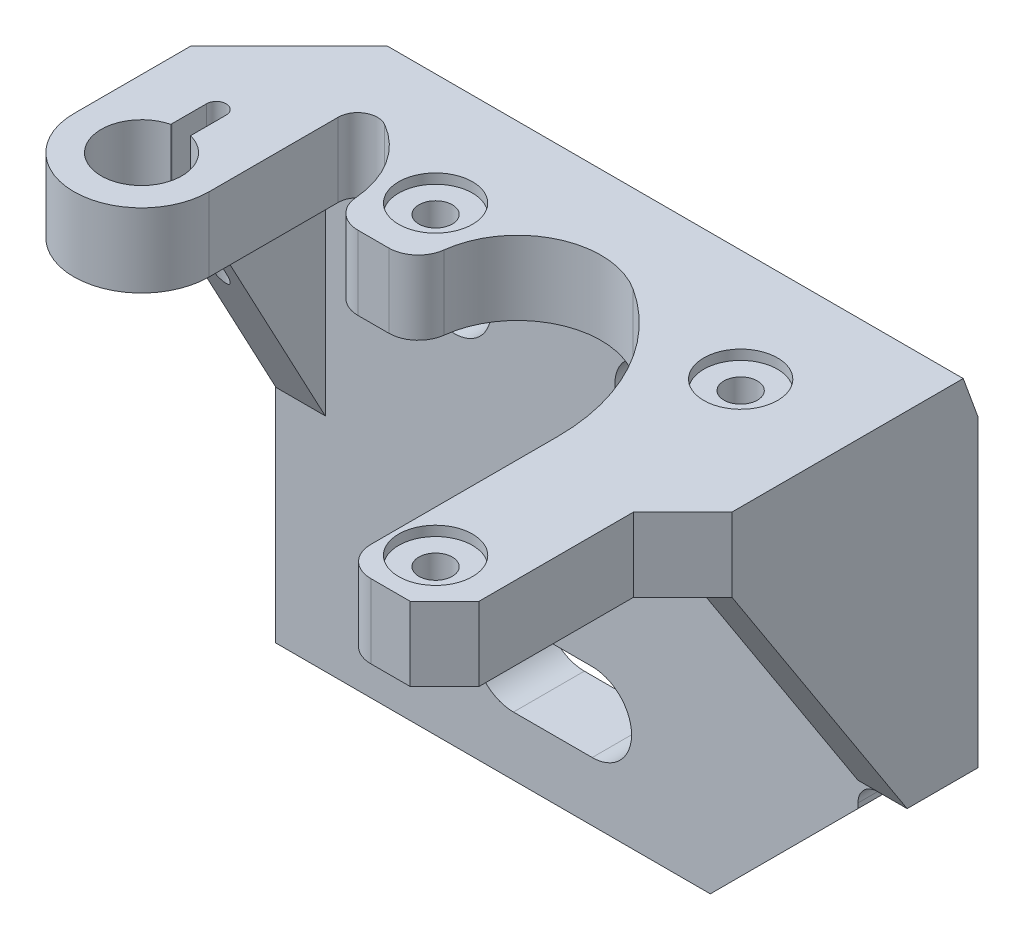
from build123d import *

# Parameters (mm, degrees)
SZKIC1_W                    = 65
SZKIC1_H                    = 52.5
SZKIC1_R                    = 1.7
DODANIE_WYCI_GNI_CIE1_DEPTH = 7.2
SZKIC2_W                    = 22.2
SZKIC2_H                    = 17.2
WYTNIJ_WYCI_GNI_CIE1_DEPTH  = 3.4
ZAOKR_GLENIE1_R             = 2
SZKIC3_R                    = 3.7
WYTNIJ_WYCI_GNI_CIE2_DEPTH  = 3.3
SZKIC4_W                    = 10.5
SZKIC4_H                    = 7.5
DODANIE_WYCI_GNI_CIE2_DEPTH = 42
SZKIC5_R                    = 3.75
WYTNIJ_WYCI_GNI_CIE3_DEPTH  = 1
WYTNIJ_WYCI_GNI_CIE4_REACH  = 80.923
SZKIC6_R                    = 1.7
ZAOKR_GLENIE2_R             = 20
SFAZOWANIE1_SIZE            = 3.5
SZKIC7_W                    = 9
SZKIC7_H                    = 7.5
DODANIE_WYCI_GNI_CIE3_DEPTH = 12
WYTNIJ_WYCI_GNI_CIE5_REACH  = 81.579
SZKIC8_R                    = 1.7
SZKIC9_R                    = 3.75
WYTNIJ_WYCI_GNI_CIE6_DEPTH  = 1
ZAOKR_GLENIE3_R             = 10
ZAOKR_GLENIE4_R             = 8.5
DODANIE_WYCI_GNI_CIE4_DEPTH = 5
SFAZOWANIE2_SIZE            = 5
ZAOKR_GLENIE5_R             = 3
SFAZOWANIE3_SIZE            = 15
SFAZOWANIE4_SIZE            = 5
SFAZOWANIE5_SIZE            = 1.5
SFAZOWANIE5_SIZE2           = 4.121216129
ZAOKR_GLENIE6_R             = 2
DODANIE_WYCI_GNI_CIE5_DEPTH = 7.5
DODANIE_WYCI_GNI_CIE6_DEPTH = 2.5
WYTNIJ_WYCI_GNI_CIE7_REACH  = 77.774
ZAOKR_GLENIE7_R             = 2
WYTNIJ_WYCI_GNI_CIE8_REACH  = 69.946
SFAZOWANIE6_SIZE            = 13
SZKIC15_W                   = 10
SZKIC15_H                   = 15
WYTNIJ_WYCI_GNI_CIE9_DEPTH  = 3.4


with BuildPart() as part:
    # Szkic1 → Dodanie-wyciągnięcie1 (new body)
    with BuildSketch(Plane.XY):
        with Locations((-1.5, -3.75)):
            Rectangle(SZKIC1_W, SZKIC1_H)
        with Locations((10, 10)):
            Circle(SZKIC1_R, mode=Mode.SUBTRACT)
        with Locations((-10, 10)):
            Circle(SZKIC1_R, mode=Mode.SUBTRACT)
        with Locations((0, -10)):
            Circle(SZKIC1_R, mode=Mode.SUBTRACT)
    extrude(amount=DODANIE_WYCI_GNI_CIE1_DEPTH)

    # Szkic2 → Wytnij-wyciągnięcie1 (cut)
    with BuildSketch(Plane(origin=(0, 0, 0), x_dir=(-1, 0, 0), z_dir=(0, 0, -1))):
        with Locations((-19.9, -21.4)):
            Rectangle(SZKIC2_W, SZKIC2_H)
    extrude(amount=-WYTNIJ_WYCI_GNI_CIE1_DEPTH, mode=Mode.SUBTRACT)

    # Zaokrąglenie1
    zaokr_glenie1_edges = [part.edges().sort_by_distance(p)[0] for p in [
        (8.8, -21.4, 3.4),
    ]]
    fillet(zaokr_glenie1_edges, radius=ZAOKR_GLENIE1_R)

    # Szkic3 → Wytnij-wyciągnięcie2 (cut)
    with BuildSketch(Plane(origin=(0, 0, 7.2), x_dir=(-1, 0, 0), z_dir=(0, 0, -1))):
        with Locations((-10, 10)):
            Circle(SZKIC3_R)
        with Locations((10, 10)):
            Circle(SZKIC3_R)
        with Locations((0, -10)):
            Circle(SZKIC3_R)
    extrude(amount=WYTNIJ_WYCI_GNI_CIE2_DEPTH, mode=Mode.SUBTRACT)

    # Szkic4 → Dodanie-wyciągnięcie2 (add)
    with BuildSketch(Plane.XY.offset(7.2)):
        with Locations((25.75, 18.75)):
            Rectangle(SZKIC4_W, SZKIC4_H)
    extrude(amount=DODANIE_WYCI_GNI_CIE2_DEPTH)

    # Szkic5 → Wytnij-wyciągnięcie3 (cut)
    with BuildSketch(Plane(origin=(0, 22.5, 0), x_dir=(1, 0, 0), z_dir=(0, 1, 0))):
        with Locations(Location((24.75, -12.865, 0), (0, 0, 270))):
            Circle(SZKIC5_R)
        with Locations(Location((24.75, -43.865, 0), (0, 0, 270))):
            Circle(SZKIC5_R)
    extrude(amount=-WYTNIJ_WYCI_GNI_CIE3_DEPTH, mode=Mode.SUBTRACT)

    # Szkic6 → Wytnij-wyciągnięcie4 (cut, up to next)
    with BuildSketch(Plane(origin=(0, 21.5, 0), x_dir=(1, 0, 0), z_dir=(0, 1, 0)), mode=Mode.PRIVATE) as wytnij_wyci_gni_cie4_sk1:
        with Locations(Location((24.75, -43.865, 0), (0, 0, 270))):
            Circle(SZKIC6_R)
    wytnij_wyci_gni_cie4_tool1 = extrude(wytnij_wyci_gni_cie4_sk1.sketch, amount=-WYTNIJ_WYCI_GNI_CIE4_REACH, mode=Mode.PRIVATE) & part.part
    # Szkic6 → Wytnij-wyciągnięcie4 (cut, up to next)
    with BuildSketch(Plane(origin=(0, 21.5, 0), x_dir=(1, 0, 0), z_dir=(0, 1, 0)), mode=Mode.PRIVATE) as wytnij_wyci_gni_cie4_sk2:
        with Locations(Location((24.75, -12.865, 0), (0, 0, 270))):
            Circle(SZKIC6_R)
    wytnij_wyci_gni_cie4_tool2 = extrude(wytnij_wyci_gni_cie4_sk2.sketch, amount=-WYTNIJ_WYCI_GNI_CIE4_REACH, mode=Mode.PRIVATE) & part.part
    add(wytnij_wyci_gni_cie4_tool1.solids().sort_by_distance((24.75, 21.5, 43.865))[0], mode=Mode.SUBTRACT)
    add(wytnij_wyci_gni_cie4_tool2.solids().sort_by_distance((24.75, 21.5, 12.865))[0], mode=Mode.SUBTRACT)

    # Zaokrąglenie2
    zaokr_glenie2_edges = [part.edges().sort_by_distance(p)[0] for p in [
        (20.5, 18.75, 7.2),
    ]]
    fillet(zaokr_glenie2_edges, radius=ZAOKR_GLENIE2_R)

    # Sfazowanie1
    sfazowanie1_edges = [part.edges().sort_by_distance(p)[0] for p in [
        (31, 18.75, 49.2),
    ]]
    chamfer(sfazowanie1_edges, length=SFAZOWANIE1_SIZE)

    # Szkic7 → Dodanie-wyciągnięcie3 (add)
    with BuildSketch(Plane.XY.offset(7.2)):
        with Locations((-6.25, 18.75)):
            Rectangle(SZKIC7_W, SZKIC7_H)
    extrude(amount=DODANIE_WYCI_GNI_CIE3_DEPTH)

    # Szkic8 → Wytnij-wyciągnięcie5 (cut, up to next)
    with BuildSketch(Plane(origin=(0, 22.5, 0), x_dir=(1, 0, 0), z_dir=(0, 1, 0)), mode=Mode.PRIVATE) as wytnij_wyci_gni_cie5_sk1:
        with Locations(Location((-6.25, -12.865, 0), (0, 0, 270))):
            Circle(SZKIC8_R)
    wytnij_wyci_gni_cie5_tool1 = extrude(wytnij_wyci_gni_cie5_sk1.sketch, amount=-WYTNIJ_WYCI_GNI_CIE5_REACH, mode=Mode.PRIVATE) & part.part
    add(wytnij_wyci_gni_cie5_tool1.solids().sort_by_distance((-6.25, 22.5, 12.865))[0], mode=Mode.SUBTRACT)

    # Szkic9 → Wytnij-wyciągnięcie6 (cut)
    with BuildSketch(Plane(origin=(0, 22.5, 0), x_dir=(1, 0, 0), z_dir=(0, 1, 0))):
        with Locations(Location((-6.25, -12.865, 0), (0, 0, 270))):
            Circle(SZKIC9_R)
    extrude(amount=-WYTNIJ_WYCI_GNI_CIE6_DEPTH, mode=Mode.SUBTRACT)

    # Zaokrąglenie3
    # the kernel refuses this fillet: 10 mm, written as the material it adds along each edge
    with BuildSketch(Plane(origin=(-1.75, 15, 7.2), x_dir=(1, 0, 0), z_dir=(0, 1, 0)), Plane(origin=(-10.75, 22.5, 7.2), x_dir=(-1, 0, 0), z_dir=(0, -1, 0))) as zaokr_glenie3_piece_1:
        with BuildLine():
            CenterArc((ZAOKR_GLENIE3_R, -ZAOKR_GLENIE3_R), ZAOKR_GLENIE3_R, 90, 90)
            Line((0, -ZAOKR_GLENIE3_R), (-ZAOKR_GLENIE3_R * 0.02, -ZAOKR_GLENIE3_R))
            Line((-ZAOKR_GLENIE3_R * 0.02, -ZAOKR_GLENIE3_R), (-ZAOKR_GLENIE3_R * 0.02, ZAOKR_GLENIE3_R * 0.02))
            Line((-ZAOKR_GLENIE3_R * 0.02, ZAOKR_GLENIE3_R * 0.02), (ZAOKR_GLENIE3_R, ZAOKR_GLENIE3_R * 0.02))
            Line((ZAOKR_GLENIE3_R, ZAOKR_GLENIE3_R * 0.02), (ZAOKR_GLENIE3_R, 0))
        make_face()
    extrude(amount=7.5)

    # Zaokrąglenie4
    zaokr_glenie4_edges = [part.edges().sort_by_distance(p)[0] for p in [
        (5.052426327, 18.75, 7.725005403),
    ]]
    fillet(zaokr_glenie4_edges, radius=ZAOKR_GLENIE4_R)

    # Szkic10 → Dodanie-wyciągnięcie4 (add)
    with BuildSketch(Plane(origin=(31, 0, 0), x_dir=(0, 0, -1), z_dir=(1, 0, 0))):
        Polygon((0, 22.5), (-25, 22.5), (-25, 15), (-7.2, -12.5), (0, -12.5), align=None)
    extrude(amount=DODANIE_WYCI_GNI_CIE4_DEPTH)

    # Sfazowanie2
    # the kernel refuses this chamfer: 5 mm, written as the material it adds along each edge
    with BuildSketch(Plane(origin=(31, 22.5, 25), x_dir=(0.9996219169112968, 0, -0.027495876610586317), z_dir=(0, -1, 0))) as sfazowanie2_piece_1_section:
        Polygon((SFAZOWANIE2_SIZE * 0.999621916911, SFAZOWANIE2_SIZE * 0.0274958766106), (-SFAZOWANIE2_SIZE * 0.0274958766106, SFAZOWANIE2_SIZE * 0.999621916911), (0, 0), align=None)
    sfazowanie2_piece_1 = extrude(amount=7.5, mode=Mode.PRIVATE)
    sfazowanie2_piece_1 = split(sfazowanie2_piece_1, bisect_by=Plane(origin=(32.903625778, 18.804901793, 27.46280916), z_dir=(0, 0.5433778467080003, -0.8394882463185397)), keep=Keep.TOP, mode=Mode.PRIVATE)
    sfazowanie2_piece_1 = split(sfazowanie2_piece_1, bisect_by=Plane(origin=(36, 19.648805529, 26.159025298), z_dir=(-1, 0, 0)), keep=Keep.TOP, mode=Mode.PRIVATE)
    add(sfazowanie2_piece_1)
    with BuildSketch(Plane(origin=(31, 22.5, 25), x_dir=(0.9996219169112968, 0, -0.027495876610586317), z_dir=(0, -1, 0))) as sfazowanie2_piece_2_section:
        Polygon((SFAZOWANIE2_SIZE * 0.999621916911, SFAZOWANIE2_SIZE * 0.0274958766106), (-SFAZOWANIE2_SIZE * 0.0274958766106, SFAZOWANIE2_SIZE * 0.999621916911), (0, 0), align=None)
    sfazowanie2_piece_2 = extrude(amount=7.5, mode=Mode.PRIVATE)
    sfazowanie2_piece_2 = split(sfazowanie2_piece_2, bisect_by=Plane(origin=(32.139386126, 17.606139304, 26.686882895), z_dir=(0, -0.5433778467080003, 0.8394882463185397)), keep=Keep.TOP, mode=Mode.PRIVATE)
    add(sfazowanie2_piece_2)

    # Zaokrąglenie5
    zaokr_glenie5_edges = [part.edges().sort_by_distance(p)[0] for p in [
        (-1.75, 18.75, 19.2),
        (-10.75, 18.75, 19.2),
        (20.5, 18.75, 49.2),
    ]]
    fillet(zaokr_glenie5_edges, radius=ZAOKR_GLENIE5_R)

    # Sfazowanie3
    sfazowanie3_edges = [part.edges().sort_by_distance(p)[0] for p in [
        (31, -30, 5.3),
    ]]
    chamfer(sfazowanie3_edges, length=SFAZOWANIE3_SIZE)

    # Sfazowanie4
    sfazowanie4_edges = [part.edges().sort_by_distance(p)[0] for p in [
        (-34, -30, 3.6),
    ]]
    chamfer(sfazowanie4_edges, length=SFAZOWANIE4_SIZE)

    # Sfazowanie5
    sfazowanie5_edges = [part.edges().sort_by_distance(p)[0] for p in [
        (1, 22.5, 0),
    ]]
    sfazowanie5_side = [part.faces().sort_by_distance(p)[0] for p in [
        (25.5, 22.5, 48.344392611),
    ]]
    chamfer(sfazowanie5_edges, length=SFAZOWANIE5_SIZE, length2=SFAZOWANIE5_SIZE2, reference=sfazowanie5_side[0])

    # Zaokrąglenie6
    # the kernel refuses this fillet: 2 mm, written as the material it adds along each edge
    with BuildSketch(Plane(origin=(31, -12.5, 7.2), x_dir=(1, 0, 0), z_dir=(0, 0, -1))) as zaokr_glenie6_piece_1_section:
        with BuildLine():
            CenterArc((ZAOKR_GLENIE6_R, ZAOKR_GLENIE6_R), ZAOKR_GLENIE6_R, 180, 90)
            Line((0, ZAOKR_GLENIE6_R), (0, 0))
            Line((0, 0), (ZAOKR_GLENIE6_R, 0))
        make_face()
    zaokr_glenie6_piece_1 = extrude(amount=7.2, mode=Mode.PRIVATE)
    zaokr_glenie6_piece_1 = split(zaokr_glenie6_piece_1, bisect_by=Plane(origin=(31.565607048, -12.662060856, 7.095102428), z_dir=(0, -0.5433778467077901, 0.8394882463186757)), keep=Keep.TOP, mode=Mode.PRIVATE)
    zaokr_glenie6_piece_1 = split(zaokr_glenie6_piece_1, bisect_by=Plane(origin=(31.565607048, -12.8, 7.138467133), z_dir=(0, 1, 0)), keep=Keep.TOP, mode=Mode.PRIVATE)
    add(zaokr_glenie6_piece_1)
    with BuildSketch(Plane(origin=(31, -12.5, 7.2), x_dir=(1, 0, 0), z_dir=(0, 0, -1))) as zaokr_glenie6_piece_2_section:
        with BuildLine():
            CenterArc((ZAOKR_GLENIE6_R, ZAOKR_GLENIE6_R), ZAOKR_GLENIE6_R, 180, 90)
            Line((0, ZAOKR_GLENIE6_R), (0, 0))
            Line((0, 0), (ZAOKR_GLENIE6_R, 0))
        make_face()
    zaokr_glenie6_piece_2 = extrude(amount=7.2, mode=Mode.PRIVATE)
    zaokr_glenie6_piece_2 = split(zaokr_glenie6_piece_2, bisect_by=Plane(origin=(31.166986877, -13.307674451, 6.677214355), z_dir=(0, -0.5433778467077901, 0.8394882463186757)), keep=Keep.TOP, mode=Mode.PRIVATE)
    zaokr_glenie6_piece_2 = split(zaokr_glenie6_piece_2, bisect_by=Plane(origin=(31.166986877, -12.8, 6.893334183), z_dir=(0, -1, 0)), keep=Keep.TOP, mode=Mode.PRIVATE)
    add(zaokr_glenie6_piece_2)
    with BuildSketch(Plane(origin=(31, -12.5, 7.2), x_dir=(1, 0, 0), z_dir=(0, 0, -1))) as zaokr_glenie6_piece_3_section:
        with BuildLine():
            CenterArc((ZAOKR_GLENIE6_R, ZAOKR_GLENIE6_R), ZAOKR_GLENIE6_R, 180, 90)
            Line((0, ZAOKR_GLENIE6_R), (0, 0))
            Line((0, 0), (ZAOKR_GLENIE6_R, 0))
        make_face()
    zaokr_glenie6_piece_3 = extrude(amount=7.2, mode=Mode.PRIVATE)
    zaokr_glenie6_piece_3 = split(zaokr_glenie6_piece_3, bisect_by=Plane(origin=(31.705553294, -13.457947623, 6.57994663), z_dir=(0, 0.5433778467077901, -0.8394882463186757)), keep=Keep.TOP, mode=Mode.PRIVATE)
    zaokr_glenie6_piece_3 = split(zaokr_glenie6_piece_3, bisect_by=Plane(origin=(31.705553294, -12.606447573, 3.4), z_dir=(0, 0, 1)), keep=Keep.TOP, mode=Mode.PRIVATE)
    zaokr_glenie6_piece_3 = split(zaokr_glenie6_piece_3, bisect_by=Plane(origin=(31.705553294, -12.8, 5.26442689), z_dir=(0, 1, 0)), keep=Keep.TOP, mode=Mode.PRIVATE)
    add(zaokr_glenie6_piece_3)
    with BuildSketch(Plane(origin=(31, -12.5, 7.2), x_dir=(1, 0, 0), z_dir=(0, 0, -1))) as zaokr_glenie6_piece_4_section:
        with BuildLine():
            CenterArc((ZAOKR_GLENIE6_R, ZAOKR_GLENIE6_R), ZAOKR_GLENIE6_R, 180, 90)
            Line((0, ZAOKR_GLENIE6_R), (0, 0))
            Line((0, 0), (ZAOKR_GLENIE6_R, 0))
        make_face()
    zaokr_glenie6_piece_4 = extrude(amount=7.2, mode=Mode.PRIVATE)
    zaokr_glenie6_piece_4 = split(zaokr_glenie6_piece_4, bisect_by=Plane(origin=(31.240391442, -13.989449718, 6.235919819), z_dir=(0, 0.5433778467077901, -0.8394882463186757)), keep=Keep.TOP, mode=Mode.PRIVATE)
    zaokr_glenie6_piece_4 = split(zaokr_glenie6_piece_4, bisect_by=Plane(origin=(31.240391442, -13.230606229, 3.4), z_dir=(0, 0, 1)), keep=Keep.TOP, mode=Mode.PRIVATE)
    zaokr_glenie6_piece_4 = split(zaokr_glenie6_piece_4, bisect_by=Plane(origin=(31.240391442, -12.8, 5.063549258), z_dir=(0, -1, 0)), keep=Keep.TOP, mode=Mode.PRIVATE)
    add(zaokr_glenie6_piece_4)
    with BuildSketch(Plane(origin=(31, -12.5, 7.2), x_dir=(1, 0, 0), z_dir=(0, 0, -1))) as zaokr_glenie6_piece_5_section:
        with BuildLine():
            CenterArc((ZAOKR_GLENIE6_R, ZAOKR_GLENIE6_R), ZAOKR_GLENIE6_R, 180, 90)
            Line((0, ZAOKR_GLENIE6_R), (0, 0))
            Line((0, 0), (ZAOKR_GLENIE6_R, 0))
        make_face()
    zaokr_glenie6_piece_5 = extrude(amount=7.2, mode=Mode.PRIVATE)
    zaokr_glenie6_piece_5 = split(zaokr_glenie6_piece_5, bisect_by=Plane(origin=(31.702896829, -12.60803603, 3.4), z_dir=(0, 0, -1)), keep=Keep.TOP, mode=Mode.PRIVATE)
    zaokr_glenie6_piece_5 = split(zaokr_glenie6_piece_5, bisect_by=Plane(origin=(31.702896829, -12.8, 1.7), z_dir=(0, 1, 0)), keep=Keep.TOP, mode=Mode.PRIVATE)
    add(zaokr_glenie6_piece_5)

    # Szkic11 → Dodanie-wyciągnięcie5 (add)
    with BuildSketch(Plane(origin=(0, 22.5, 0), x_dir=(1, 0, 0), z_dir=(0, 1, 0))):
        with BuildLine():
            Line((-20.75, -7.2), (-32.5, -7.2))
            Line((-32.5, -7.2), (-32.5, -23.37))
            ThreePointArc((-32.5, -23.37), (-25.625, -30.245), (-18.75, -23.37))
            Line((-18.75, -23.37), (-18.75, -7.402041029))
            ThreePointArc((-18.75, -7.402041029), (-19.74491038, -7.25063847), (-20.75, -7.2))
        make_face()
        with BuildLine():
            ThreePointArc((-26.617536095, -19.39195122), (-26.62313228, -19.331089708), (-26.625, -19.27))
            Line((-26.625, -19.27), (-26.625, -15.77))
            ThreePointArc((-26.625, -15.77), (-25.625, -14.77), (-24.625, -15.77))
            Line((-24.625, -15.77), (-24.625, -19.27))
            ThreePointArc((-24.625, -19.27), (-24.62686772, -19.331089708), (-24.632463905, -19.39195122))
            ThreePointArc((-24.632463905, -19.39195122), (-22.393947695, -20.846054477), (-21.525, -23.37))
            ThreePointArc((-21.525, -23.37), (-28.148945523, -26.601052305), (-26.617536095, -19.39195122))
        make_face(mode=Mode.SUBTRACT)
    extrude(amount=-DODANIE_WYCI_GNI_CIE5_DEPTH)

    # Szkic12 → Dodanie-wyciągnięcie6 (add, symmetric)
    with BuildSketch(Plane.ZY.offset(25.625)):
        Polygon((19.2, 15), (7.2, -7.5), (7.2, 15), align=None)
    extrude(amount=DODANIE_WYCI_GNI_CIE6_DEPTH, both=True)

    # Szkic13 → Wytnij-wyciągnięcie7 (cut, up to next)
    with BuildSketch(Plane(origin=(0, 15, 0), x_dir=(1, 0, 0), z_dir=(0, 1, 0)), mode=Mode.PRIVATE) as wytnij_wyci_gni_cie7_sk1:
        with BuildLine():
            Line((-26.625, -15.77), (-26.625, -19.2))
            Line((-26.625, -19.2), (-24.625, -19.2))
            Line((-24.625, -19.2), (-24.625, -15.77))
            ThreePointArc((-24.625, -15.77), (-25.625, -14.77), (-26.625, -15.77))
        make_face()
    wytnij_wyci_gni_cie7_tool1 = extrude(wytnij_wyci_gni_cie7_sk1.sketch, amount=-WYTNIJ_WYCI_GNI_CIE7_REACH, mode=Mode.PRIVATE) & part.part
    add(wytnij_wyci_gni_cie7_tool1.solids().sort_by_distance((-25.625, 15, 17.086392))[0], mode=Mode.SUBTRACT)

    # Zaokrąglenie7
    # the kernel refuses this fillet: 2 mm, written as the material it adds along each edge
    with BuildSketch(Plane(origin=(-32.5, 22.5, 7.2), x_dir=(0, 0, 1), z_dir=(0, -1, 0))) as zaokr_glenie7_piece_1:
        with BuildLine():
            CenterArc((1.936491673, 2), ZAOKR_GLENIE7_R, 194.477512186, 75.522487814)
            Line((0, 1.5), (-0.038729833, 1.49))
            ThreePointArc((-0.038729833, 1.49), (-0.04, 0.75), (-0.04, 0))
            Line((-0.04, 0), (0, -0.04))
            Line((0, -0.04), (1.936491673, -0.04))
            Line((1.936491673, -0.04), (1.936491673, 0))
        make_face()
    extrude(amount=7.5)
    with BuildSketch(Plane(origin=(-18.75, 22.5, 7.402041029), x_dir=(0, 0, 1), z_dir=(0, -1, 0))) as zaokr_glenie7_piece_2:
        with BuildLine():
            CenterArc((2.869755741, -2), ZAOKR_GLENIE7_R, 90, 120)
            Line((1.137704933, -3), (1.103063917, -3.02))
            ThreePointArc((1.103063917, -3.02), (0.410349214, -1.560109977), (-0.039191836, -0.008))
            Line((-0.039191836, -0.008), (0, 0.04))
            Line((0, 0.04), (2.869755741, 0.04))
            Line((2.869755741, 0.04), (2.869755741, 0))
        make_face()
    extrude(amount=7.5)

    # Szkic14 → Wytnij-wyciągnięcie8 (cut, up to next)
    with BuildSketch(Plane(origin=(0, 0, 0), x_dir=(-1, 0, 0), z_dir=(0, 0, -1)), mode=Mode.PRIVATE) as wytnij_wyci_gni_cie8_sk1:
        with BuildLine():
            Line((-4, -24), (4, -24))
            ThreePointArc((4, -24), (8, -20), (4, -16))
            Line((4, -16), (-4, -16))
            ThreePointArc((-4, -16), (-8, -20), (-4, -24))
        make_face()
    wytnij_wyci_gni_cie8_tool1 = extrude(wytnij_wyci_gni_cie8_sk1.sketch, amount=-WYTNIJ_WYCI_GNI_CIE8_REACH, mode=Mode.PRIVATE) & part.part
    add(wytnij_wyci_gni_cie8_tool1.solids().sort_by_distance((0, -20, 0))[0], mode=Mode.SUBTRACT)

    # Sfazowanie6
    # the kernel refuses this chamfer: 13 mm, written as the material it takes off along each edge
    with BuildSketch(Plane(origin=(-34, -58.431878844, 0), x_dir=(-0.027495876610586424, 0, 0.9996219169112968), z_dir=(0, 1, 0))) as sfazowanie6_piece_1:
        Polygon((SFAZOWANIE6_SIZE * 0.999621916911, SFAZOWANIE6_SIZE * 0.0274958766106), (-SFAZOWANIE6_SIZE * 0.0274958766106, SFAZOWANIE6_SIZE * 0.999621916911), (0, 0), align=None)
    extrude(amount=110.242541558, mode=Mode.SUBTRACT)

    # Szkic15 → Wytnij-wyciągnięcie9 (cut)
    with BuildSketch(Plane(origin=(0, 0, 0), x_dir=(-1, 0, 0), z_dir=(0, 0, -1))):
        with Locations((-23, -5.3)):
            Rectangle(SZKIC15_W, SZKIC15_H)
    extrude(amount=-WYTNIJ_WYCI_GNI_CIE9_DEPTH, mode=Mode.SUBTRACT)


solid = part.part
